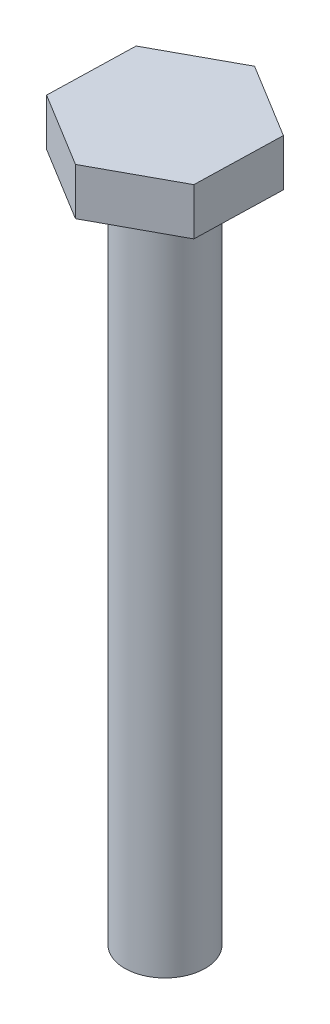
from build123d import *

# Parameters (mm, degrees)
BOSS_EXTRUDE1_DEPTH = 3.5
SKETCH2_R           = 3
BOSS_EXTRUDE2_DEPTH = 50


with BuildPart() as part:
    # Sketch1 → Boss-Extrude1 (new body)
    with BuildSketch(Plane(origin=(0, 0, 0), x_dir=(1, 0, 0), z_dir=(0, 1, 0))):
        Polygon((5.543350936, -3.394298218), (5.711223953, 3.103533624), (0.167873017, 6.497831842), (-5.543350936, 3.394298218), (-5.711223953, -3.103533624), (-0.167873017, -6.497831842), align=None)
    extrude(amount=BOSS_EXTRUDE1_DEPTH)

    # Sketch2 → Boss-Extrude2 (add)
    with BuildSketch(Plane.XZ):
        Circle(SKETCH2_R)
    extrude(amount=BOSS_EXTRUDE2_DEPTH)


solid = part.part
